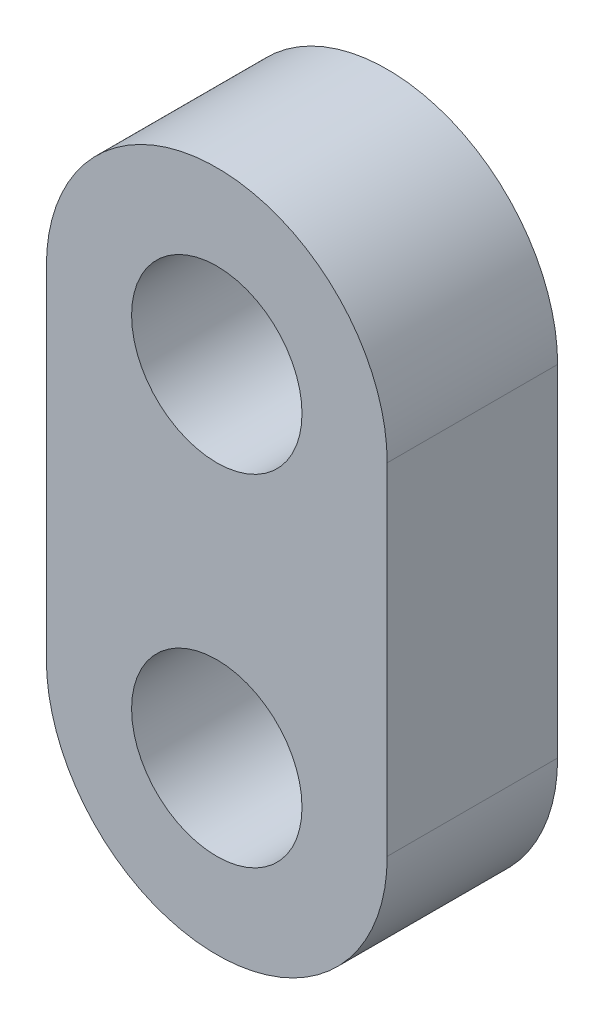
from build123d import *

# Parameters (mm, degrees)
SKETCH1_R           = 3.175
BOSS_EXTRUDE1_DEPTH = 6.35


with BuildPart() as part:
    # Sketch1 → Boss-Extrude1 (new body)
    with BuildSketch(Plane.XY):
        with BuildLine():
            Line((-6.35, 12.7), (-6.35, 0))
            ThreePointArc((-6.35, 0), (0, -6.35), (6.35, 0))
            Line((6.35, 0), (6.35, 12.7))
            ThreePointArc((6.35, 12.7), (0, 19.05), (-6.35, 12.7))
        make_face()
        Circle(SKETCH1_R, mode=Mode.SUBTRACT)
        with Locations((0, 12.7)):
            Circle(SKETCH1_R, mode=Mode.SUBTRACT)
    extrude(amount=BOSS_EXTRUDE1_DEPTH)


solid = part.part
